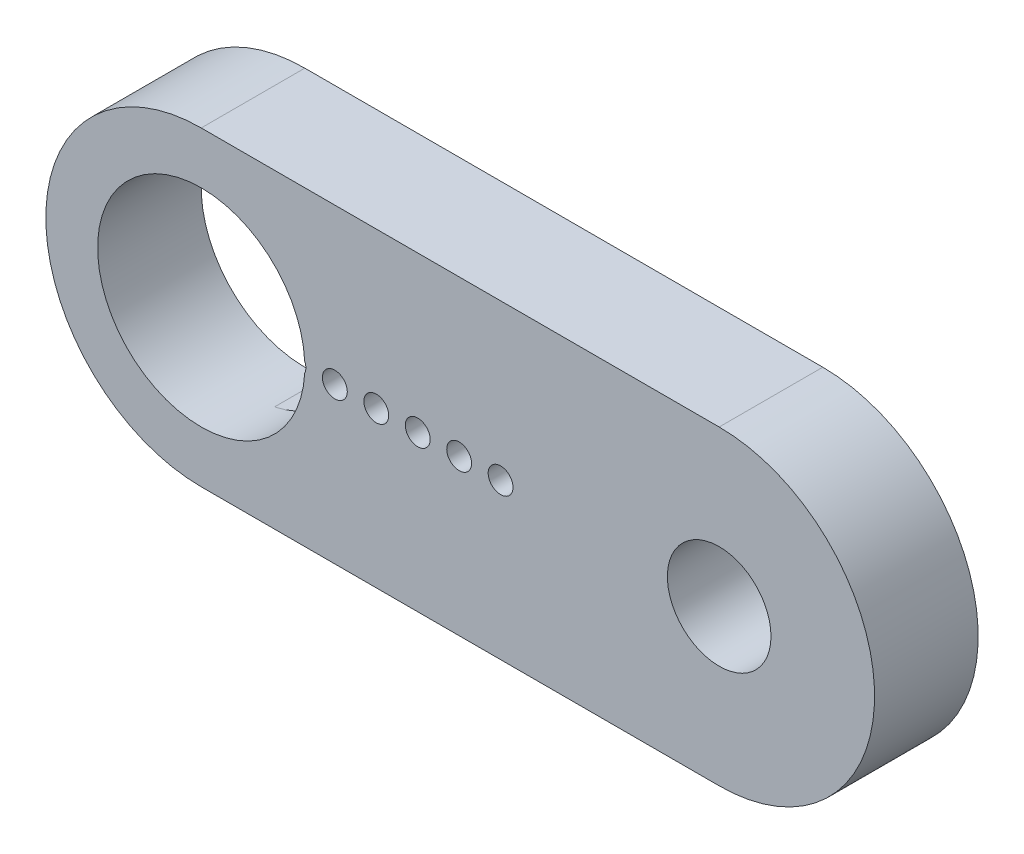
from build123d import *

# Parameters (mm, degrees)
SKETCH1_R           = 5
SKETCH1_R_2         = 2.5
BOSS_EXTRUDE1_DEPTH = 5
SKETCH7_R           = 0.6
CUT_EXTRUDE1_DEPTH  = 10
SKETCH8_R           = 0.6
CUT_EXTRUDE2_DEPTH  = 2.5


with BuildPart() as part:
    # Sketch1 → Boss-Extrude1 (new body)
    with BuildSketch(Plane.XY):
        with BuildLine():
            Line((0, 7.5), (25, 7.5))
            ThreePointArc((25, 7.5), (32.5, 0), (25, -7.5))
            Line((25, -7.5), (0, -7.5))
            ThreePointArc((0, -7.5), (-7.5, 0), (0, 7.5))
        make_face()
        Circle(SKETCH1_R, mode=Mode.SUBTRACT)
        with Locations((25, 0)):
            Circle(SKETCH1_R_2, mode=Mode.SUBTRACT)
    extrude(amount=BOSS_EXTRUDE1_DEPTH)

    # Sketch7 → Cut-Extrude1 (cut)
    with BuildSketch(Plane(origin=(0, 0, 0), x_dir=(-1, 0, 0), z_dir=(0, 0, -1))):
        with Locations((-4.45, 0)):
            Circle(SKETCH7_R)
        with Locations((-6.45, 0)):
            Circle(SKETCH7_R)
        with Locations((-8.45, 0)):
            Circle(SKETCH7_R)
        with Locations((-10.45, 0)):
            Circle(SKETCH7_R)
        with Locations((-12.45, 0)):
            Circle(SKETCH7_R)
        with Locations((-14.45, 0)):
            Circle(SKETCH7_R)
    extrude(amount=-CUT_EXTRUDE1_DEPTH, mode=Mode.SUBTRACT)

    # Sketch8 → Cut-Extrude2 (cut)
    # profile 1 of 3: a face of its own
    with BuildSketch(Plane(origin=(0, 0, 0), x_dir=(-1, 0, 0), z_dir=(0, 0, -1))):
        with BuildLine():
            Line((-1.038062284, 4.891055785), (-14.865224913, 1.956422314))
            ThreePointArc((-14.865224913, 1.956422314), (-13.438479361, 1.72534808), (-12.54, 0.593211598))
            ThreePointArc((-12.54, 0.593211598), (-12.058847856, 0.454972527), (-11.85, 0))
            Line((-11.85, 0), (-11.05, 0))
            ThreePointArc((-11.05, 0), (-10.45, 0.6), (-9.85, 0))
            Line((-9.85, 0), (-9.05, 0))
            ThreePointArc((-9.05, 0), (-8.45, 0.6), (-7.85, 0))
            Line((-7.85, 0), (-7.05, 0))
            ThreePointArc((-7.05, 0), (-6.45, 0.6), (-5.85, 0))
            Line((-5.85, 0), (-5.05, 0))
            ThreePointArc((-5.05, 0), (-5.035714775, 0.130146849), (-4.993539326, 0.254096441))
            ThreePointArc((-4.993539326, 0.254096441), (-3.803998224, 3.244934131), (-1.038062284, 4.891055785))
        make_face()
    # profile 2 of 3: a face of its own
    with BuildSketch(Plane(origin=(0, 0, 0), x_dir=(-1, 0, 0), z_dir=(0, 0, -1))):
        with BuildLine():
            ThreePointArc((-12.54, 0.593211598), (-13.438479361, 1.72534808), (-14.865224913, 1.956422314))
            ThreePointArc((-14.865224913, 1.956422314), (-16.45, 0), (-14.865224913, -1.956422314))
            ThreePointArc((-14.865224913, -1.956422314), (-13.438479361, -1.72534808), (-12.54, -0.593211598))
            ThreePointArc((-12.54, -0.593211598), (-12.904972527, -0.391152144), (-13.05, 0))
            ThreePointArc((-13.05, 0), (-12.904972527, 0.391152144), (-12.54, 0.593211598))
        make_face()
        with Locations((-14.45, 0)):
            Circle(SKETCH8_R, mode=Mode.SUBTRACT)
    # profile 3 of 3: a face of its own
    with BuildSketch(Plane(origin=(0, 0, 0), x_dir=(-1, 0, 0), z_dir=(0, 0, -1))):
        with BuildLine():
            ThreePointArc((-12.54, -0.593211598), (-13.438479361, -1.72534808), (-14.865224913, -1.956422314))
            Line((-14.865224913, -1.956422314), (-1.038062284, -4.891055785))
            ThreePointArc((-1.038062284, -4.891055785), (-3.803998224, -3.244934131), (-4.993539326, -0.254096441))
            ThreePointArc((-4.993539326, -0.254096441), (-5.035714775, -0.130146849), (-5.05, 0))
            Line((-5.05, 0), (-5.85, 0))
            ThreePointArc((-5.85, 0), (-6.45, -0.6), (-7.05, 0))
            Line((-7.05, 0), (-7.85, 0))
            ThreePointArc((-7.85, 0), (-8.45, -0.6), (-9.05, 0))
            Line((-9.05, 0), (-9.85, 0))
            ThreePointArc((-9.85, 0), (-10.45, -0.6), (-11.05, 0))
            Line((-11.05, 0), (-11.85, 0))
            ThreePointArc((-11.85, 0), (-12.058847856, -0.454972527), (-12.54, -0.593211598))
        make_face()
    extrude(amount=-CUT_EXTRUDE2_DEPTH, mode=Mode.SUBTRACT)


with BuildPart() as cut_extrude2_kept_piece:
    # of the separate pieces the step leaves, the one the design keeps (cut_extrude2_pieces_kept)
    add(part.part.solids().sort_by_distance((11.85, 0, 5))[0])


solid = cut_extrude2_kept_piece.part
